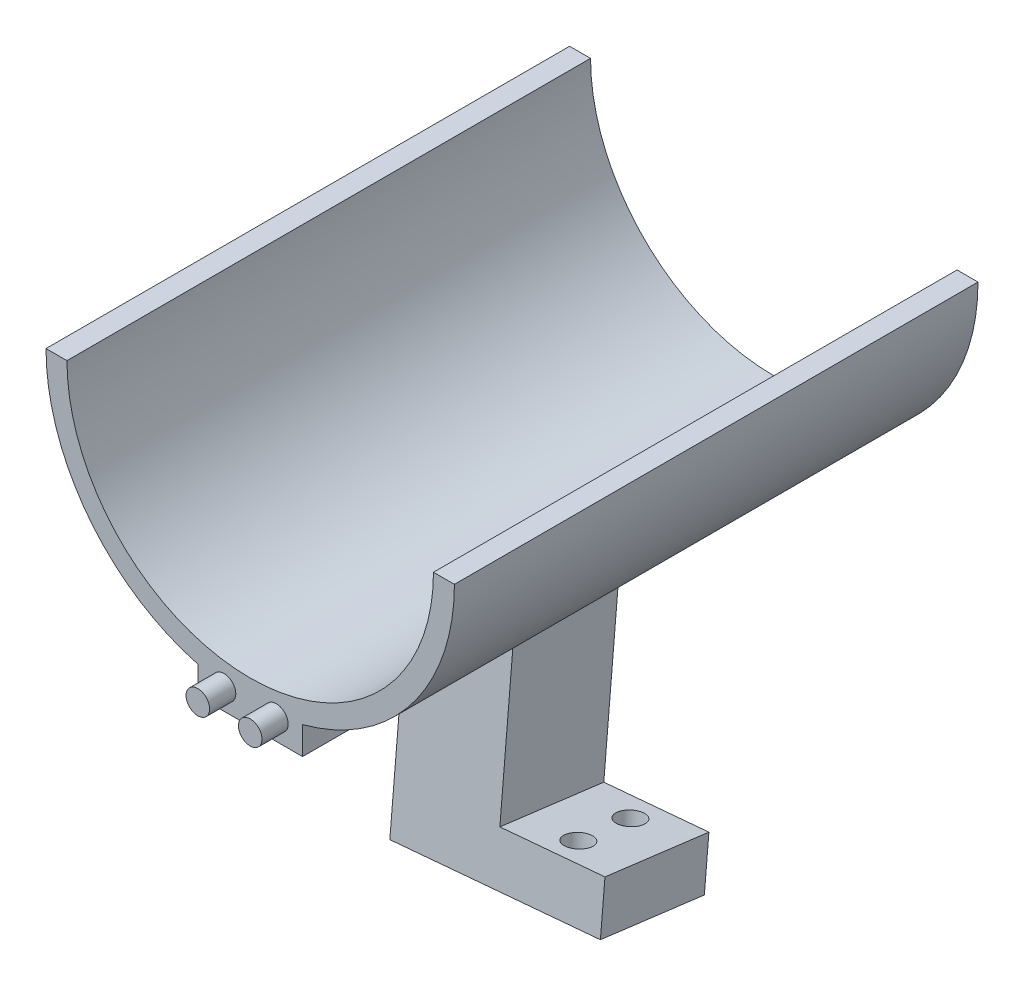
from build123d import *

# Parameters (mm, degrees)
EXTRUDE_THIN1_DEPTH       = 100
BOSS_EXTRUDE1_START       = -10
BOSS_EXTRUDE1_DEPTH       = 10
SKETCH3_R                 = 2.25
BOSS_EXTRUDE2_DEPTH       = 5
BOSS_EXTRUDE3_DEPTH       = 10
SKETCH5_R                 = 2.25
CUT_EXTRUDE1_DEPTH        = 6
BOSS_EXTRUDE4_REACH       = 121.416
BOSS_EXTRUDE4_END_RADIUS  = 39
SKETCH10_W                = 20
SKETCH10_H                = 20
BOSS_EXTRUDE5_START       = -39.491913729
BOSS_EXTRUDE5_OUTLINE_W   = 20
BOSS_EXTRUDE5_OUTLINE_H   = 20
BOSS_EXTRUDE5_DEPTH       = 39.491913729
BOSS_EXTRUDE5_START_2     = 91.246721786
BOSS_EXTRUDE5_2_OUTLINE_W = 23
BOSS_EXTRUDE5_2_OUTLINE_H = 23
BOSS_EXTRUDE5_2_DEPTH     = 3.753278214
BOSS_EXTRUDE6_DEPTH       = 20
SKETCH12_R                = 2.5
CUT_EXTRUDE2_DEPTH        = 20


with BuildPart() as part:
    # Sketch1 → Extrude-Thin1 (new body)
    with BuildSketch(Plane.XY):
        with BuildLine():
            ThreePointArc((-35, 0), (0, -35), (35, 0))
            Line((35, 0), (39, 0))
            ThreePointArc((39, 0), (0, -39), (-39, 0))
            Line((-39, 0), (-35, 0))
        make_face()
    extrude(amount=EXTRUDE_THIN1_DEPTH)

    # Sketch2 → Boss-Extrude1 (add)
    with BuildSketch(Plane.XY.offset(100).offset(BOSS_EXTRUDE1_START)):
        with BuildLine():
            Line((0, -39), (0, -35))
            Line((0, -35), (-10, -35))
            Line((-10, -35), (-10, -37.69615365))
            ThreePointArc((-10, -37.69615365), (-5.042321274, -38.672664715), (0, -39))
        make_face()
        with BuildLine():
            Line((10, -35), (0, -35))
            Line((0, -35), (0, -39))
            ThreePointArc((0, -39), (5.042321274, -38.672664715), (10, -37.69615365))
            Line((10, -37.69615365), (10, -35))
        make_face()
        with BuildLine():
            ThreePointArc((10, -37.69615365), (5.042321274, -38.672664715), (0, -39))
            ThreePointArc((0, -39), (-5.042321274, -38.672664715), (-10, -37.69615365))
            Line((-10, -37.69615365), (-10, -43))
            Line((-10, -43), (10, -43))
            Line((10, -43), (10, -37.69615365))
        make_face()
    extrude(amount=BOSS_EXTRUDE1_DEPTH)

    # Sketch3 → Boss-Extrude2 (add)
    with BuildSketch(Plane.XY.offset(100)):
        with Locations((-5, -39)):
            Circle(SKETCH3_R)
        with Locations((5, -39)):
            Circle(SKETCH3_R)
    extrude(amount=BOSS_EXTRUDE2_DEPTH)

    # Sketch4 → Boss-Extrude3 (add)
    with BuildSketch(Plane(origin=(0, 0, 0), x_dir=(-1, 0, 0), z_dir=(0, 0, -1))):
        with BuildLine():
            Line((0, -39), (0, -35))
            Line((0, -35), (-10, -35))
            Line((-10, -35), (-10, -37.69615365))
            ThreePointArc((-10, -37.69615365), (-5.042321274, -38.672664715), (0, -39))
        make_face()
        with BuildLine():
            ThreePointArc((10, -37.69615365), (5.042321274, -38.672664715), (0, -39))
            ThreePointArc((0, -39), (-5.042321274, -38.672664715), (-10, -37.69615365))
            Line((-10, -37.69615365), (-10, -43))
            Line((-10, -43), (10, -43))
            Line((10, -43), (10, -37.69615365))
        make_face()
        with BuildLine():
            Line((10, -35), (0, -35))
            Line((0, -35), (0, -39))
            ThreePointArc((0, -39), (5.042321274, -38.672664715), (10, -37.69615365))
            Line((10, -37.69615365), (10, -35))
        make_face()
    extrude(amount=-BOSS_EXTRUDE3_DEPTH)

    # Sketch5 → Cut-Extrude1 (cut)
    with BuildSketch(Plane(origin=(0, 0, 0), x_dir=(-1, 0, 0), z_dir=(0, 0, -1))):
        with Locations(Location((-5, -39, 0), (0, 0, 180))):
            Circle(SKETCH5_R)
        with Locations(Location((5, -39, 0), (0, 0, 180))):
            Circle(SKETCH5_R)
    extrude(amount=-CUT_EXTRUDE1_DEPTH, mode=Mode.SUBTRACT)

    # Boss-Extrude4: up to this cylinder (the profile starts outside it)
    boss_extrude4_end = Plane(origin=(0, 0, 50), z_dir=(0, 0, -1)) * Cylinder(BOSS_EXTRUDE4_END_RADIUS, 321.832, mode=Mode.PRIVATE)
    # Sketch10 → Boss-Extrude4 (add, up to the surface)
    with BuildSketch(Plane(origin=(0, -51.355775573, 4.493048169), x_dir=(1, 0, 0), z_dir=(0, 0.9961946980917462, -0.08715574274765152)), mode=Mode.PRIVATE) as boss_extrude4_sk1:
        with Locations((0, -45.680780994)):
            Rectangle(SKETCH10_W, SKETCH10_H)
    boss_extrude4_tool1 = extrude(boss_extrude4_sk1.sketch, amount=BOSS_EXTRUDE4_REACH, mode=Mode.PRIVATE) - boss_extrude4_end
    add(boss_extrude4_tool1.solids().sort_by_distance((0, -47.374433, 50))[0])

    # Boss-Extrude5: read off the stored shape, not the designer's step
    # Boss-Extrude5 outline → Boss-Extrude5 (add)
    with BuildSketch(Plane(origin=(0, -51.355775573, 4.493048169), x_dir=(1, 0, 0), z_dir=(0, 0.9961946980917462, -0.08715574274765152)).offset(BOSS_EXTRUDE5_START)):
        with Locations((0, -45.680780994)):
            Rectangle(BOSS_EXTRUDE5_OUTLINE_W, BOSS_EXTRUDE5_OUTLINE_H)
    extrude(amount=BOSS_EXTRUDE5_DEPTH)

    # Boss-Extrude5 2 outline → Boss-Extrude5 2 (cut)
    with BuildSketch(Plane(origin=(0, 0, 0), x_dir=(0.9966522374056314, 0.08110432407614805, -0.01031534248099727), z_dir=(0.08175767654690974, -0.9886876617314986, 0.12574732548071507)).offset(BOSS_EXTRUDE5_START_2)):
        with Locations((-7.5, 42.5)):
            Rectangle(BOSS_EXTRUDE5_2_OUTLINE_W, BOSS_EXTRUDE5_2_OUTLINE_H)
    extrude(amount=BOSS_EXTRUDE5_2_DEPTH, mode=Mode.SUBTRACT)

    # Sketch11 → Boss-Extrude6 (add, along a direction that is not the sketch's normal)
    with BuildSketch(Plane(origin=(10, 0, 0), x_dir=(0, 0, -1), z_dir=(1, 0, 0))):
        Polygon((-63.192356491, -83.426625408), (-43.336898209, -85.951963664), (-42.465340782, -75.990016683), (-62.320799064, -73.464678427), align=None)
    extrude(amount=BOSS_EXTRUDE6_DEPTH, dir=(0.9966471031139101, 0.0815088903864268, -0.007131103885417095))

    # Sketch12 → Cut-Extrude2 (cut)
    with BuildSketch(Plane(origin=(6.645907522, -80.368315802, 10.221732461), x_dir=(0.9966522374056314, 0.08110432407614805, -0.010315342480997362), z_dir=(-0.08175767654690974, 0.9886876617314985, -0.12574732548071624))):
        with Locations(Location((13.36525587, -47.585828212, 0), (0, 0, 270))):
            Circle(SKETCH12_R)
        with Locations(Location((13.36525587, -37.57047174, 0), (0, 0, 270))):
            Circle(SKETCH12_R)
    extrude(amount=-CUT_EXTRUDE2_DEPTH, mode=Mode.SUBTRACT)


solid = part.part
